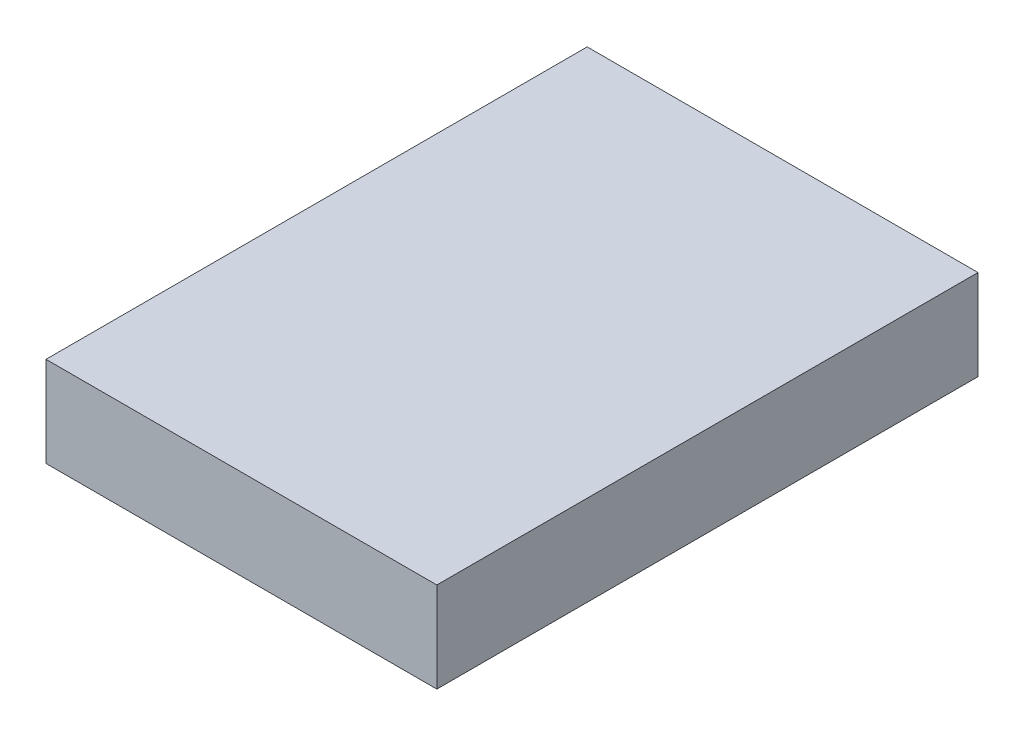
from build123d import *

# Parameters (mm, degrees)
SKETCH1_W           = 165.1
SKETCH1_H           = 38.1
BOSS_EXTRUDE1_DEPTH = 228.6


with BuildPart() as part:
    # Sketch1 → Boss-Extrude1 (new body)
    with BuildSketch(Plane.XY):
        Rectangle(SKETCH1_W, SKETCH1_H)
    extrude(amount=BOSS_EXTRUDE1_DEPTH)


solid = part.part
